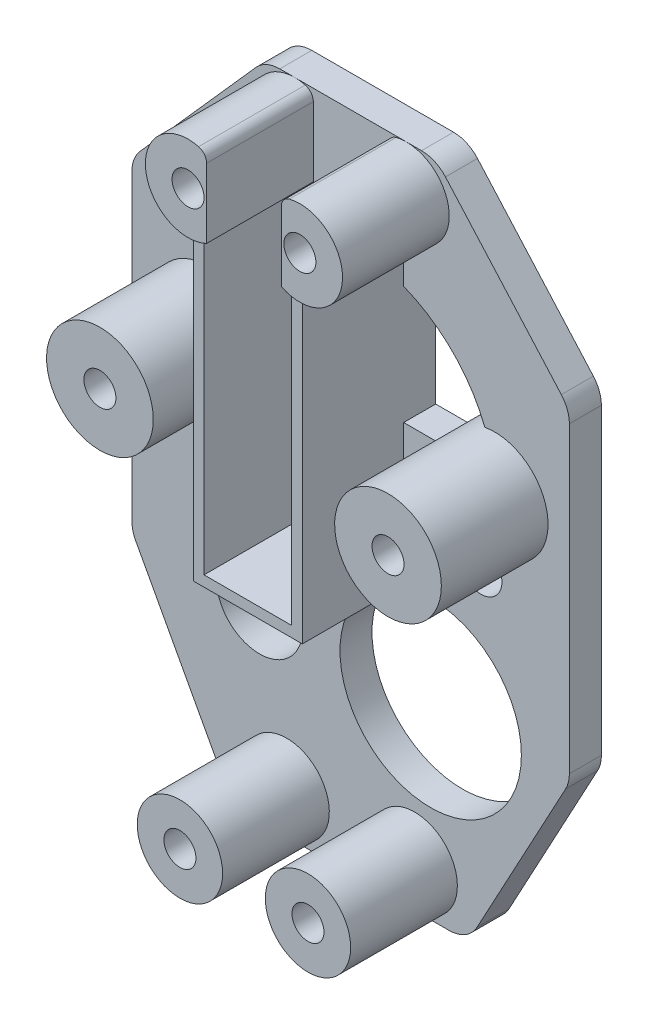
from build123d import *
from build123d.topology import SkipClean

# Parameters (mm, degrees)
SKETCH1_R            = 1.5
SKETCH1_R_2          = 8.5
BOSS_EXTRUDE1_DEPTH  = 3
FILLET1_R            = 3
SKETCH5_R            = 5
SKETCH5_R_2          = 1.5
BOSS_EXTRUDE3_DEPTH  = 10
SKETCH6_R            = 5
SKETCH6_R_2          = 1.5
SKETCH6_R_3          = 4
BOSS_EXTRUDE5_DEPTH  = 10
SKETCH7_W            = 7
SKETCH7_H            = 10
CUT_EXTRUDE1_DEPTH   = 12
FILLET2_R            = 1
SKETCH9_W            = 10.209522868
SKETCH9_H            = 28.518860908
BOSS_EXTRUDE6_DEPTH  = 12.5
SHELL1_START         = 1
SHELL1_OUTLINE_W     = 8.209522868
SHELL1_OUTLINE_H     = 27.518860908
SHELL1_OUTLINE_R     = 4
SHELL1_OUTLINE_R_2   = 2.5
SHELL1_OUTLINE_R_3   = 3
SHELL1_DEPTH         = 11
SHELL1_2_OUTLINE_W   = 0.530301734
SHELL1_2_OUTLINE_H   = 1
SHELL1_2_OUTLINE_W_2 = 0.260175398
SHELL1_2_DEPTH       = 1
SHELL1_START_2       = 12
SHELL1_3_OUTLINE_W   = 8.209522868
SHELL1_3_OUTLINE_H   = 27.518860908
SHELL1_3_DEPTH       = 0.5


# Read off the part's stored shape, not the designer's step: Shell1
with BuildPart() as part:
    # Sketch1 → Boss-Extrude1 (new body)
    with BuildSketch(Plane.XY):
        Polygon((7.989824602, 62), (-7.989824602, 62), (-20.5, 47.899715907), (-20.5, 17.599715907), (-11, 0), (0, 0), (11, 0), (20.5, 17.599715907), (20.5, 47.899715907), align=None)
        with Locations((-6, 4)):
            Circle(SKETCH1_R, mode=Mode.SUBTRACT)
        with Locations((-13.5, 37.599715907)):
            Circle(SKETCH1_R, mode=Mode.SUBTRACT)
        with Locations((-5.239824602, 58)):
            Circle(SKETCH1_R, mode=Mode.SUBTRACT)
        with Locations(Location((5.239824602, 58, 0), (0, 0, 180))):
            Circle(SKETCH1_R, mode=Mode.SUBTRACT)
        with Locations(Location((13.5, 37.599715907, 0), (0, 0, 180))):
            Circle(SKETCH1_R, mode=Mode.SUBTRACT)
        with Locations(Location((6, 4, 0), (0, 0, 180))):
            Circle(SKETCH1_R, mode=Mode.SUBTRACT)
        with Locations((7.5, 17.599715907)):
            Circle(SKETCH1_R_2, mode=Mode.SUBTRACT)
        with BuildLine():
            Line((8.730303993, 36.099715907), (-8.730303993, 36.099715907))
            ThreePointArc((-8.730303993, 36.099715907), (-10.179901517, 33.861140502), (-12.574074074, 32.686197699))
            Line((-12.574074074, 32.686197699), (-12.574074074, 17.599715907))
            ThreePointArc((-12.574074074, 17.599715907), (-8.537037037, 13.56267887), (-4.5, 17.599715907))
            ThreePointArc((-4.5, 17.599715907), (0.591550042, 27.411612725), (11.545553196, 28.897215601))
            ThreePointArc((11.545553196, 28.897215601), (14.109803486, 30.235235992), (12.574074074, 32.686197699))
            ThreePointArc((12.574074074, 32.686197699), (10.179901517, 33.861140502), (8.730303993, 36.099715907))
        make_face(mode=Mode.SUBTRACT)
        with BuildLine():
            Line((8.730303993, 39.099715907), (-8.730303993, 39.099715907))
            ThreePointArc((-8.730303993, 39.099715907), (-10.179901517, 41.338291312), (-12.574074074, 42.513234115))
            ThreePointArc((-12.574074074, 42.513234115), (0, 51.099715907), (12.574074074, 42.513234115))
            ThreePointArc((12.574074074, 42.513234115), (10.179901517, 41.338291312), (8.730303993, 39.099715907))
        make_face(mode=Mode.SUBTRACT)
    extrude(amount=BOSS_EXTRUDE1_DEPTH)

    # Fillet1
    fillet1_edges = [part.edges().sort_by_distance(p)[0] for p in [
        (-11, 0, 1.5),
        (-20.5, 17.599715907, 1.5),
        (-20.5, 47.899715907, 1.5),
        (-7.989824602, 62, 1.5),
        (7.989824602, 62, 1.5),
        (20.5, 47.899715907, 1.5),
        (20.5, 17.599715907, 1.5),
        (11, 0, 1.5),
    ]]
    fillet(fillet1_edges, radius=FILLET1_R)

    # Sketch5 → Boss-Extrude3 (add)
    with SkipClean():  # the faces are left unmerged after this step: merging them gives an invalid solid
        with BuildSketch(Plane.XY.offset(3)):
            with Locations(Location((-13.5, 37.599715907, 0), (0, 0, 79.328070714))):
                Circle(SKETCH5_R)
            with Locations((-13.5, 37.599715907)):
                Circle(SKETCH5_R_2, mode=Mode.SUBTRACT)
        extrude(amount=BOSS_EXTRUDE3_DEPTH)

    # Sketch6 → Boss-Extrude5 (add)
    # profile 1 of 5: a face of its own
    with SkipClean():  # the faces are left unmerged after this step: merging them gives an invalid solid
        with BuildSketch(Plane.XY.offset(3)):
            with Locations(Location((13.5, 37.599715907, 0), (0, 0, 162.542396876))):
                Circle(SKETCH6_R)
            with Locations(Location((13.5, 37.599715907, 0), (0, 0, 180))):
                Circle(SKETCH6_R_2, mode=Mode.SUBTRACT)
        # profile 2 of 5: a face of its own
        with BuildSketch(Plane.XY.offset(3)):
            with Locations(Location((-6, 4, 0), (0, 0, 270))):
                Circle(SKETCH6_R_3)
            with Locations((-6, 4)):
                Circle(SKETCH6_R_2, mode=Mode.SUBTRACT)
        # profile 3 of 5: a face of its own
        with BuildSketch(Plane.XY.offset(3)):
            with Locations(Location((6, 4, 0), (0, 0, 270))):
                Circle(SKETCH6_R_3)
            with Locations(Location((6, 4, 0), (0, 0, 180))):
                Circle(SKETCH6_R_2, mode=Mode.SUBTRACT)
        # profile 4 of 5: a face of its own
        with BuildSketch(Plane.XY.offset(3)):
            with Locations(Location((-5.239824602, 58, 0), (0, 0, 90))):
                Circle(SKETCH6_R_3)
            with Locations((-5.239824602, 58)):
                Circle(SKETCH6_R_2, mode=Mode.SUBTRACT)
        # profile 5 of 5: a face of its own
        with BuildSketch(Plane.XY.offset(3)):
            with Locations(Location((5.239824602, 58, 0), (0, 0, 90))):
                Circle(SKETCH6_R_3)
            with Locations(Location((5.239824602, 58, 0), (0, 0, 180))):
                Circle(SKETCH6_R_2, mode=Mode.SUBTRACT)
        extrude(amount=BOSS_EXTRUDE5_DEPTH)

    # Sketch7 → Cut-Extrude1 (cut)
    with SkipClean():  # the faces are left unmerged after this step: merging them gives an invalid solid
        with BuildSketch(Plane(origin=(0, 62, 0), x_dir=(1, 0, 0), z_dir=(0, 1, 0))):
            with Locations((0, -8)):
                Rectangle(SKETCH7_W, SKETCH7_H)
        extrude(amount=-CUT_EXTRUDE1_DEPTH, mode=Mode.SUBTRACT)

    # Fillet2
    fillet2_edges = [part.edges().sort_by_distance(p)[0] for p in [
        (3.5, 61.60180654, 8),
        (-3.5, 61.60180654, 8),
    ]]
    fillet(fillet2_edges, radius=FILLET2_R)

    # Sketch9 → Boss-Extrude6 (add)
    with BuildSketch(Plane(origin=(0, 0, 0), x_dir=(-1, 0, 0), z_dir=(0, 0, -1))):
        with Locations((0.135063168, 40.138763006)):
            Rectangle(SKETCH9_W, SKETCH9_H)
    extrude(amount=-BOSS_EXTRUDE6_DEPTH)

    # Shell1 outline → Shell1 (cut)
    # profile 1 of 7: a face of its own
    with SkipClean():  # the faces are left unmerged after this step: merging them gives an invalid solid
        with BuildSketch(Plane.XY.offset(SHELL1_START)):
            with Locations((-0.135063168, 40.638763006)):
                Rectangle(SHELL1_OUTLINE_W, SHELL1_OUTLINE_H)
        # profile 2 of 7: a face of its own
        with BuildSketch(Plane.XY.offset(SHELL1_START)):
            with BuildLine():
                Line((4.5, 55.611975804), (4.5, 55.092654207))
                ThreePointArc((4.5, 55.092654207), (8.239824602, 58), (4.5, 60.907345793))
                Line((4.5, 60.907345793), (4.5, 60.388024196))
                ThreePointArc((4.5, 60.388024196), (7.739824602, 58), (4.5, 55.611975804))
            make_face()
        # profile 3 of 7: a face of its own
        with BuildSketch(Plane.XY.offset(SHELL1_START)):
            with Locations((13.5, 37.599715907)):
                Circle(SHELL1_OUTLINE_R)
            with Locations((13.5, 37.599715907)):
                Circle(SHELL1_OUTLINE_R_2, mode=Mode.SUBTRACT)
        # profile 4 of 7: a face of its own
        with BuildSketch(Plane.XY.offset(SHELL1_START)):
            with BuildLine():
                ThreePointArc((-4.5, 60.907345793), (-8.239824602, 58), (-4.5, 55.092654207))
                Line((-4.5, 55.092654207), (-4.5, 55.611975804))
                ThreePointArc((-4.5, 55.611975804), (-7.739824602, 58), (-4.5, 60.388024196))
                Line((-4.5, 60.388024196), (-4.5, 60.907345793))
            make_face()
        # profile 5 of 7: a face of its own
        with BuildSketch(Plane.XY.offset(SHELL1_START)):
            with Locations((-13.5, 37.599715907)):
                Circle(SHELL1_OUTLINE_R)
            with Locations((-13.5, 37.599715907)):
                Circle(SHELL1_OUTLINE_R_2, mode=Mode.SUBTRACT)
        # profile 6 of 7: a face of its own
        with BuildSketch(Plane.XY.offset(SHELL1_START)):
            with Locations((-6, 4)):
                Circle(SHELL1_OUTLINE_R_3)
            with Locations((-6, 4)):
                Circle(SHELL1_OUTLINE_R_2, mode=Mode.SUBTRACT)
        # profile 7 of 7: a face of its own
        with BuildSketch(Plane.XY.offset(SHELL1_START)):
            with Locations((6, 4)):
                Circle(SHELL1_OUTLINE_R_3)
            with Locations((6, 4)):
                Circle(SHELL1_OUTLINE_R_2, mode=Mode.SUBTRACT)
        extrude(amount=SHELL1_DEPTH, mode=Mode.SUBTRACT)

    # Shell1 2 outline → Shell1 2 (cut)
    with SkipClean():  # the faces are left unmerged after this step: merging them gives an invalid solid
        with BuildSketch(Plane.XY.offset(SHELL1_START)):
            Polygon((4.5, 54.39819346), (3.969698266, 54.39819346), (3.969698266, 53.976186467), (4.5, 54.138334164), align=None)
            with BuildLine():
                Line((3.5, 54.39819346), (3.969698266, 54.39819346))
                Line((3.969698266, 54.39819346), (4.5, 54.39819346))
                Line((4.5, 54.39819346), (4.5, 55.092654207))
                Line((4.5, 55.092654207), (4.5, 55.611975804))
                ThreePointArc((4.5, 55.611975804), (2.739824602, 58), (4.5, 60.388024196))
                Line((4.5, 60.388024196), (4.5, 60.907345793))
                Line((4.5, 60.907345793), (4.5, 61))
                Line((4.5, 61), (-4.5, 61))
                Line((-4.5, 61), (-4.5, 60.907345793))
                Line((-4.5, 60.907345793), (-4.5, 60.388024196))
                ThreePointArc((-4.5, 60.388024196), (-3.227417896, 59.483313604), (-2.739824602, 58))
                ThreePointArc((-2.739824602, 58), (-3.227417896, 56.516686396), (-4.5, 55.611975804))
                Line((-4.5, 55.611975804), (-4.5, 55.092654207))
                Line((-4.5, 55.092654207), (-4.5, 54.39819346))
                Line((-4.5, 54.39819346), (-4.239824602, 54.39819346))
                Line((-4.239824602, 54.39819346), (-3.5, 54.39819346))
                Line((-3.5, 54.39819346), (3.5, 54.39819346))
            make_face()
            with BuildLine():
                Line((4.5, 54.138334164), (3.969698266, 53.976186467))
                Line((3.969698266, 53.976186467), (3.969698266, 51.54573669))
                ThreePointArc((3.969698266, 51.54573669), (4.235623439, 51.467285777), (4.5, 51.383764659))
                Line((4.5, 51.383764659), (4.5, 54.138334164))
            make_face()
            Polygon((5.349866128, 54.39819346), (4.5, 54.39819346), (4.5, 54.138334164), align=None)
            with BuildLine():
                Line((4.5, 55.092654207), (4.5, 54.39819346))
                Line((4.5, 54.39819346), (5.349866128, 54.39819346))
                Line((5.349866128, 54.39819346), (11.680198125, 56.333787271))
                Line((11.680198125, 56.333787271), (8.137004291, 60.327339565))
                ThreePointArc((8.137004291, 60.327339565), (7.461111715, 60.824099659), (6.640952928, 61))
                Line((6.640952928, 61), (5.239824601, 61))
                ThreePointArc((5.239824601, 61), (8.216570928, 57.627198027), (4.5, 55.092654207))
            make_face()
            with BuildLine():
                Line((5.349866128, 54.39819346), (4.5, 54.138334164))
                Line((4.5, 54.138334164), (4.5, 51.383764659))
                ThreePointArc((4.5, 51.383764659), (10.445219214, 47.656922058), (13.944444444, 41.574947867))
                ThreePointArc((13.944444444, 41.574947867), (16.308577774, 40.447854051), (17.468626967, 38.099715907))
                Line((17.468626967, 38.099715907), (19.221016497, 38.099715907))
                Line((19.221016497, 38.099715907), (19.5, 38.277294649))
                Line((19.5, 38.277294649), (19.5, 46.760711275))
                ThreePointArc((19.5, 46.760711275), (19.369773078, 47.470604674), (18.996051363, 48.08805084))
                Line((18.996051363, 48.08805084), (13.397512324, 54.39819346))
                Line((13.397512324, 54.39819346), (5.349866128, 54.39819346))
            make_face()
            Polygon((11.680198125, 56.333787271), (5.349866128, 54.39819346), (13.397512324, 54.39819346), align=None)
            Polygon((-4.239824602, 53.882555858), (-4.239824602, 54.39819346), (-4.5, 54.39819346), (-4.5, 53.956614103), align=None)
            with Locations((4.234849133, 37.599715907)):
                Rectangle(SHELL1_2_OUTLINE_W, SHELL1_2_OUTLINE_H)
            with BuildLine():
                Line((-4.239824602, 51.466001904), (-4.239824602, 53.882555858))
                Line((-4.239824602, 53.882555858), (-4.5, 53.956614103))
                Line((-4.5, 53.956614103), (-4.5, 51.383764659))
                ThreePointArc((-4.5, 51.383764659), (-4.370105749, 51.425495297), (-4.239824602, 51.466001904))
            make_face()
            with BuildLine():
                ThreePointArc((4.5, 60.907345793), (4.867022629, 60.976746326), (5.239824601, 61))
                Line((5.239824601, 61), (4.5, 61))
                Line((4.5, 61), (4.5, 60.907345793))
            make_face()
            with BuildLine():
                Line((-6.051320648, 54.39819346), (-4.5, 54.39819346))
                Line((-4.5, 54.39819346), (-4.5, 55.092654207))
                ThreePointArc((-4.5, 55.092654207), (-8.216570928, 57.627198027), (-5.239824602, 61))
                Line((-5.239824602, 61), (-6.640952928, 61))
                ThreePointArc((-6.640952928, 61), (-7.461111715, 60.824099659), (-8.137004291, 60.327339565))
                Line((-8.137004291, 60.327339565), (-11.916322066, 56.067650742))
                Line((-11.916322066, 56.067650742), (-6.051320648, 54.39819346))
            make_face()
            Polygon((-4.5, 53.956614103), (-4.5, 54.39819346), (-6.051320648, 54.39819346), align=None)
            with BuildLine():
                Line((9.531373033, 38.099715907), (4.5, 38.099715907))
                Line((4.5, 38.099715907), (4.5, 37.099715907))
                Line((4.5, 37.099715907), (9.531373033, 37.099715907))
                ThreePointArc((9.531373033, 37.099715907), (9.5, 37.599715907), (9.531373033, 38.099715907))
            make_face()
            with Locations((-4.369912301, 37.599715907)):
                Rectangle(SHELL1_2_OUTLINE_W_2, SHELL1_2_OUTLINE_H)
            with BuildLine():
                Line((-4.5, 51.383764659), (-4.5, 53.956614103))
                Line((-4.5, 53.956614103), (-6.051320648, 54.39819346))
                Line((-6.051320648, 54.39819346), (-13.397512324, 54.39819346))
                Line((-13.397512324, 54.39819346), (-13.574074074, 54.199189788))
                Line((-13.574074074, 54.199189788), (-13.574074074, 42.698197349))
                ThreePointArc((-13.574074074, 42.698197349), (-10.026355683, 48.074552025), (-4.5, 51.383764659))
            make_face()
            Polygon((-13.397512324, 54.39819346), (-6.051320648, 54.39819346), (-11.916322066, 56.067650742), align=None)
            with BuildLine():
                Line((19.221016497, 38.099715907), (17.468626967, 38.099715907))
                ThreePointArc((17.468626967, 38.099715907), (17.492149037, 37.850207557), (17.5, 37.599715907))
                ThreePointArc((17.5, 37.599715907), (17.492149037, 37.349224257), (17.468626967, 37.099715907))
                Line((17.468626967, 37.099715907), (17.64997539, 37.099715907))
                Line((17.64997539, 37.099715907), (19.221016497, 38.099715907))
            make_face()
            with BuildLine():
                Line((-4.5, 37.099715907), (-4.5, 38.099715907))
                Line((-4.5, 38.099715907), (-9.531373033, 38.099715907))
                ThreePointArc((-9.531373033, 38.099715907), (-9.518369529, 37.982624238), (-9.508819977, 37.865200408))
                Line((-9.508819977, 37.865200408), (-5.44670018, 37.099715907))
                Line((-5.44670018, 37.099715907), (-4.5, 37.099715907))
            make_face()
            with BuildLine():
                ThreePointArc((-13.944444444, 41.574947867), (-13.770716674, 42.140350475), (-13.574074074, 42.698197349))
                Line((-13.574074074, 42.698197349), (-13.574074074, 54.199189788))
                Line((-13.574074074, 54.199189788), (-18.996051363, 48.08805084))
                ThreePointArc((-18.996051363, 48.08805084), (-19.369773078, 47.470604674), (-19.5, 46.760711275))
                Line((-19.5, 46.760711275), (-19.5, 39.747984234))
                Line((-19.5, 39.747984234), (-17.120809654, 39.299638684))
                ThreePointArc((-17.120809654, 39.299638684), (-15.829341257, 40.85151069), (-13.944444444, 41.574947867))
            make_face()
            with BuildLine():
                Line((-4.5, 60.907345793), (-4.5, 61))
                Line((-4.5, 61), (-5.239824602, 61))
                ThreePointArc((-5.239824602, 61), (-4.867022629, 60.976746326), (-4.5, 60.907345793))
            make_face()
            Polygon((19.5, 38.277294649), (19.221016497, 38.099715907), (19.5, 38.099715907), align=None)
            Polygon((19.5, 38.099715907), (19.221016497, 38.099715907), (17.64997539, 37.099715907), (19.5, 37.099715907), align=None)
            with BuildLine():
                Line((17.64997539, 37.099715907), (17.468626967, 37.099715907))
                ThreePointArc((17.468626967, 37.099715907), (17.460104306, 37.036178967), (17.450564499, 36.97278677))
                Line((17.450564499, 36.97278677), (17.64997539, 37.099715907))
            make_face()
            with BuildLine():
                Line((19.5, 37.099715907), (17.64997539, 37.099715907))
                Line((17.64997539, 37.099715907), (17.450564499, 36.97278677))
                ThreePointArc((17.450564499, 36.97278677), (16.949794876, 35.575138096), (15.973774606, 34.456399315))
                Line((15.973774606, 34.456399315), (19.5, 22.086994304))
                Line((19.5, 22.086994304), (19.5, 37.099715907))
            make_face()
            with BuildLine():
                ThreePointArc((4.5, 28.182721151), (4.233808337, 28.103619563), (3.969698266, 28.017823684))
                Line((3.969698266, 28.017823684), (3.969698266, 26.879332552))
                Line((3.969698266, 26.879332552), (1.593333011, 26.879332552))
                ThreePointArc((1.593333011, 26.879332552), (-2.142959527, 22.892478093), (-3.5, 17.599715907))
                ThreePointArc((-3.5, 17.599715907), (-3.756532504, 16.012731812), (-4.5, 14.587395527))
                Line((-4.5, 14.587395527), (-4.5, 6.598076211))
                ThreePointArc((-4.5, 6.598076211), (-3.401923789, 5.5), (-3, 4))
                ThreePointArc((-3, 4), (-3.401923789, 2.5), (-4.5, 1.401923789))
                Line((-4.5, 1.401923789), (-4.5, 1))
                Line((-4.5, 1), (4.5, 1))
                Line((4.5, 1), (4.5, 1.401923789))
                ThreePointArc((4.5, 1.401923789), (3, 4), (4.5, 6.598076211))
                Line((4.5, 6.598076211), (4.5, 8.585837718))
                ThreePointArc((4.5, 8.585837718), (-2, 17.599715907), (4.5, 26.613594096))
                Line((4.5, 26.613594096), (4.5, 28.182721151))
            make_face()
            with BuildLine():
                Line((-9.531373033, 37.099715907), (-5.44670018, 37.099715907))
                Line((-5.44670018, 37.099715907), (-9.508819977, 37.865200408))
                ThreePointArc((-9.508819977, 37.865200408), (-9.502205602, 37.732531392), (-9.5, 37.599715907))
                ThreePointArc((-9.5, 37.599715907), (-9.507850963, 37.349224257), (-9.531373033, 37.099715907))
            make_face()
            with BuildLine():
                ThreePointArc((-17.468626967, 38.099715907), (-17.341853813, 38.713340295), (-17.120809654, 39.299638684))
                Line((-17.120809654, 39.299638684), (-19.5, 39.747984234))
                Line((-19.5, 39.747984234), (-19.5, 38.099715907))
                Line((-19.5, 38.099715907), (-17.468626967, 38.099715907))
            make_face()
            with BuildLine():
                ThreePointArc((15.973774606, 34.456399315), (14.451782464, 33.714601991), (12.759259259, 33.668901341))
                ThreePointArc((12.759259259, 33.668901341), (15.074879424, 29.973265698), (11.208423763, 27.955757293))
                ThreePointArc((11.208423763, 27.955757293), (7.871946509, 28.593425736), (4.5, 28.182721151))
                Line((4.5, 28.182721151), (4.5, 26.613594096))
                ThreePointArc((4.5, 26.613594096), (13.056527693, 25.305233411), (17, 17.599715907))
                ThreePointArc((17, 17.599715907), (13.056527693, 9.894198403), (4.5, 8.585837718))
                Line((4.5, 8.585837718), (4.5, 6.598076211))
                ThreePointArc((4.5, 6.598076211), (7.5, 6.598076211), (9, 4))
                ThreePointArc((9, 4), (8.121320344, 1.878679656), (6, 1))
                Line((6, 1), (9.210198382, 1))
                ThreePointArc((9.210198382, 1), (10.234893459, 1.282443596), (10.970169973, 2.05))
                Line((10.970169973, 2.05), (19.259971591, 17.407700357))
                ThreePointArc((19.259971591, 17.407700357), (19.439064617, 17.867773414), (19.5, 18.357700357))
                Line((19.5, 18.357700357), (19.5, 22.086994304))
                Line((19.5, 22.086994304), (15.973774606, 34.456399315))
            make_face()
            with BuildLine():
                ThreePointArc((-17.468626967, 37.099715907), (-17.5, 37.599715907), (-17.468626967, 38.099715907))
                Line((-17.468626967, 38.099715907), (-19.5, 38.099715907))
                Line((-19.5, 38.099715907), (-19.5, 37.099715907))
                Line((-19.5, 37.099715907), (-17.468626967, 37.099715907))
            make_face()
            with BuildLine():
                Line((-4.5, 6.598076211), (-4.5, 14.587395527))
                ThreePointArc((-4.5, 14.587395527), (-10.124021132, 12.819211374), (-13.574074074, 17.599715907))
                Line((-13.574074074, 17.599715907), (-13.574074074, 22.072904385))
                Line((-13.574074074, 22.072904385), (-19.5, 20.064832762))
                Line((-19.5, 20.064832762), (-19.5, 18.357700357))
                ThreePointArc((-19.5, 18.357700357), (-19.439064617, 17.867773414), (-19.259971591, 17.407700357))
                Line((-19.259971591, 17.407700357), (-10.970169973, 2.05))
                ThreePointArc((-10.970169973, 2.05), (-10.234893459, 1.282443596), (-9.210198382, 1))
                Line((-9.210198382, 1), (-6, 1))
                ThreePointArc((-6, 1), (-8.897777479, 4.776457135), (-4.5, 6.598076211))
            make_face()
            with BuildLine():
                Line((-19.5, 20.064832762), (-13.574074074, 22.072904385))
                Line((-13.574074074, 22.072904385), (-13.574074074, 33.600401837))
                ThreePointArc((-13.574074074, 33.600401837), (-14.843899604, 33.832232151), (-15.973774607, 34.456399316))
                Line((-15.973774607, 34.456399316), (-19.5, 22.086994321))
                Line((-19.5, 22.086994321), (-19.5, 20.064832762))
            make_face()
            with BuildLine():
                ThreePointArc((-15.973774607, 34.456399316), (-16.981797691, 35.63068446), (-17.468626967, 37.099715907))
                Line((-17.468626967, 37.099715907), (-19.5, 37.099715907))
                Line((-19.5, 37.099715907), (-19.5, 22.086994321))
                Line((-19.5, 22.086994321), (-15.973774607, 34.456399316))
            make_face()
            with BuildLine():
                ThreePointArc((-4.5, 1.401923789), (-5.223542865, 1.102222521), (-6, 1))
                Line((-6, 1), (-4.5, 1))
                Line((-4.5, 1), (-4.5, 1.401923789))
            make_face()
            with BuildLine():
                Line((4.5, 1.401923789), (4.5, 1))
                Line((4.5, 1), (6, 1))
                ThreePointArc((6, 1), (5.223542865, 1.102222521), (4.5, 1.401923789))
            make_face()
        extrude(amount=SHELL1_2_DEPTH, mode=Mode.SUBTRACT)

    # Shell1 3 outline → Shell1 3 (cut)
    with SkipClean():  # the faces are left unmerged after this step: merging them gives an invalid solid
        with BuildSketch(Plane.XY.offset(SHELL1_START_2)):
            with Locations((-0.135063168, 40.638763006)):
                Rectangle(SHELL1_3_OUTLINE_W, SHELL1_3_OUTLINE_H)
        extrude(amount=SHELL1_3_DEPTH, mode=Mode.SUBTRACT)


solid = part.part
